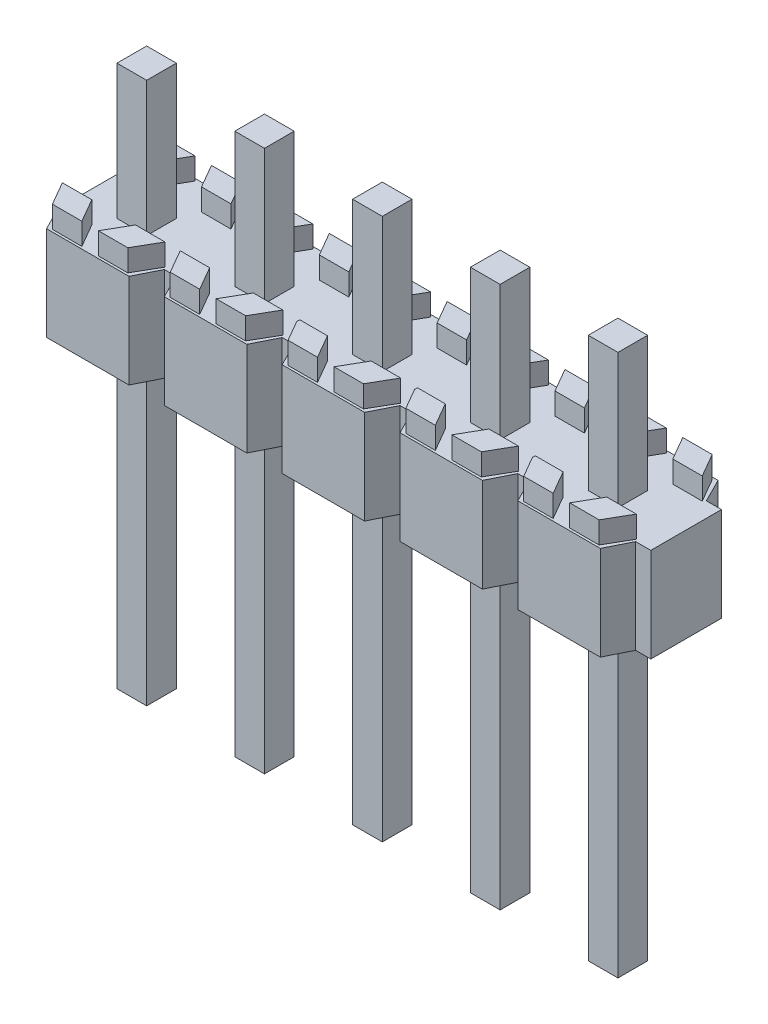
from build123d import *

# Parameters (mm, degrees)
BOSS_EXTRUDE1_START = -1.02
SKETCH1_W           = 0.64
SKETCH1_H           = 0.64
BOSS_EXTRUDE1_DEPTH = 2.5
CUT_EXTRUDE2_DEPTH  = 0.47
SKETCH3_W           = 0.64
SKETCH3_H           = 0.64
BOSS_EXTRUDE2_DEPTH = 2.9
SKETCH4_W           = 0.64
SKETCH4_H           = 0.64
BOSS_EXTRUDE3_DEPTH = 6.75
LPATTERN1_COUNT     = 5
LPATTERN1_PITCH     = 2.54


with BuildPart() as part:
    # Sketch1 → Boss-Extrude1 (new body)
    with BuildSketch(Plane(origin=(0, 0, 0), x_dir=(1, 0, 0), z_dir=(0, 1, 0)).offset(BOSS_EXTRUDE1_START)):
        Polygon((-1.143, 0.762), (-0.889, 1.27), (0.889, 1.27), (1.143, 0.762), (1.47, 0.762), (1.47, -0.762), (1.143, -0.762), (0.889, -1.27), (-0.889, -1.27), (-1.143, -0.762), align=None)
        Rectangle(SKETCH1_W, SKETCH1_H, mode=Mode.SUBTRACT)
    boss_extrude1 = extrude(amount=BOSS_EXTRUDE1_DEPTH)

    # Sketch2 → Cut-Extrude2 (cut)
    with BuildSketch(Plane(origin=(0, 1.48, 0), x_dir=(1, 0, 0), z_dir=(0, 1, 0))):
        Polygon((-1.143, 0.762), (-1.143, -0.762), (-0.889, -1.27), (0.889, -1.27), (1.143, -0.762), (1.47, -0.762), (1.47, 0.762), (1.143, 0.762), (0.889, 1.27), (-0.889, 1.27), align=None)
        Polygon((-1.106093937, -0.7112), (-0.471093937, -0.7112), (-0.1778, -1.2192), (-0.8128, -1.2192), align=None, mode=Mode.SUBTRACT)
        Polygon((-0.8128, 1.2192), (-1.106093937, 0.7112), (-0.471093937, 0.7112), (-0.1778, 1.2192), align=None, mode=Mode.SUBTRACT)
        Polygon((1.106093937, 0.7112), (0.471093937, 0.7112), (0.1778, 1.2192), (0.8128, 1.2192), align=None, mode=Mode.SUBTRACT)
        Polygon((0.8128, -1.2192), (1.106093937, -0.7112), (0.471093937, -0.7112), (0.1778, -1.2192), align=None, mode=Mode.SUBTRACT)
    cut_extrude2 = extrude(amount=-CUT_EXTRUDE2_DEPTH, mode=Mode.SUBTRACT)


with BuildPart() as body_2:
    # Sketch3 → Boss-Extrude2 (new body)
    with BuildSketch(Plane(origin=(0, 1.01, 0), x_dir=(1, 0, 0), z_dir=(0, 1, 0))):
        Rectangle(SKETCH3_W, SKETCH3_H)
    boss_extrude2 = extrude(amount=BOSS_EXTRUDE2_DEPTH)


with BuildPart() as body_3:
    # Sketch4 → Boss-Extrude3 (new body)
    with BuildSketch(Plane.XZ.offset(1.02)):
        Rectangle(SKETCH4_W, SKETCH4_H)
    boss_extrude3 = extrude(amount=BOSS_EXTRUDE3_DEPTH)


with BuildPart() as part_1:
    add(part.part)

    # LPattern1: Boss-Extrude1, Cut-Extrude2, Boss-Extrude2, Boss-Extrude3 ×5
    with Locations(*[(i * LPATTERN1_PITCH, 0, 0) for i in range(1, LPATTERN1_COUNT)]):
        add(boss_extrude1)
        add(cut_extrude2, mode=Mode.SUBTRACT)
        add(boss_extrude2)
        add(boss_extrude3)


solid = Compound([body_2.part, body_3.part, part_1.part])
